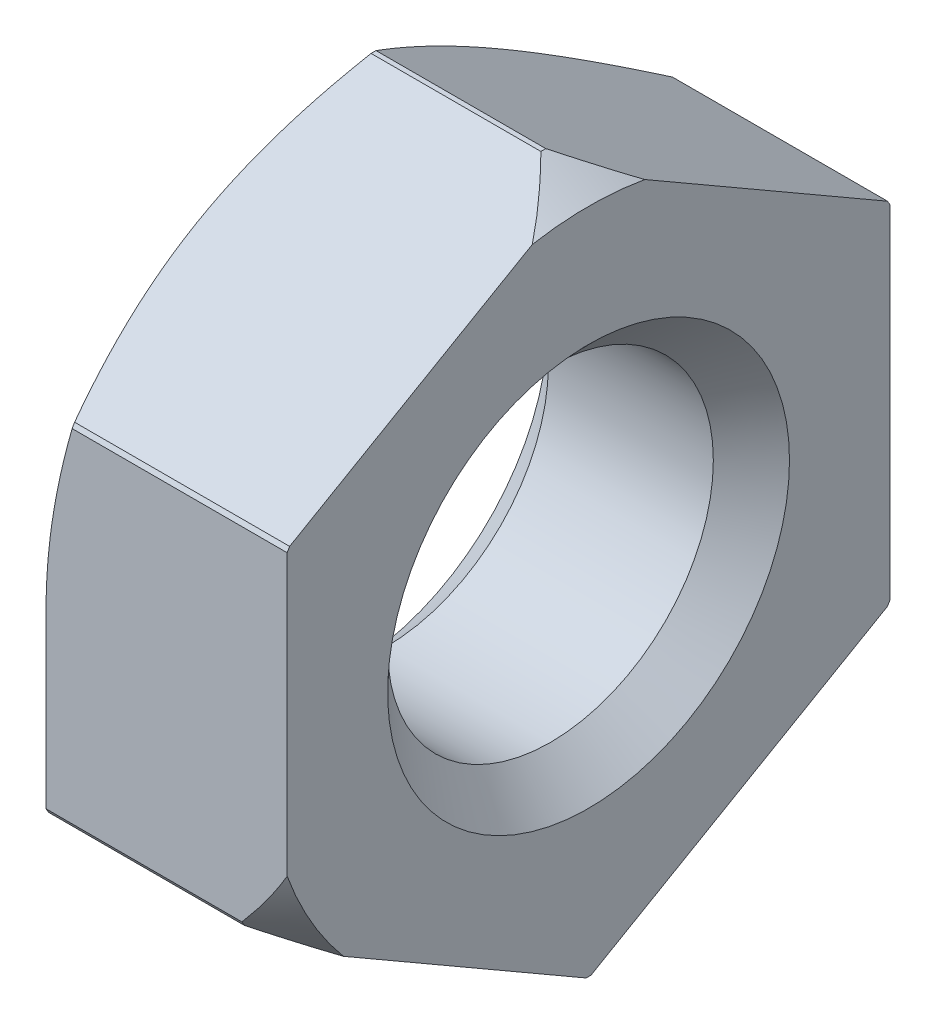
from build123d import *
from OCP.BRepFilletAPI import BRepFilletAPI_MakeChamfer

# Parameters (mm, degrees)
EXTRUDE_1_DEPTH    = 2.4
HOLE_WIZARD_M3_1_D = 3.242
CHAMFER_1_SIZE     = 0.45
CHAMFER_1_SIZE_2   = 0.259807621
CHAMFER_3_SIZE     = 0.379


with BuildPart() as part:
    # 草圖1 → 填料-伸長1 (new body)
    with BuildSketch(Plane(origin=(0, 0, 0), x_dir=(0, -1, 0), z_dir=(-1, 0, 0))):
        with BuildLine():
            Line((-1.746239959, 2.975423668), (-3.449912463, 0.024576332))
            ThreePointArc((-3.449912463, 0.024576332), (-3.45, 0), (-3.449912463, -0.024576332))
            Line((-3.449912463, -0.024576332), (-1.746239959, -2.975423668))
            ThreePointArc((-1.746239959, -2.975423668), (-1.725, -2.987787643), (-1.703672504, -3))
            Line((-1.703672504, -3), (1.703672504, -3))
            ThreePointArc((1.703672504, -3), (1.725, -2.987787643), (1.746239959, -2.975423668))
            Line((1.746239959, -2.975423668), (3.449912463, -0.024576332))
            ThreePointArc((3.449912463, -0.024576332), (3.45, 0), (3.449912463, 0.024576332))
            Line((3.449912463, 0.024576332), (1.746239959, 2.975423668))
            ThreePointArc((1.746239959, 2.975423668), (1.725, 2.987787643), (1.703672504, 3))
            Line((1.703672504, 3), (-1.703672504, 3))
            ThreePointArc((-1.703672504, 3), (-1.725, 2.987787643), (-1.746239959, 2.975423668))
        make_face()
    extrude(amount=-EXTRUDE_1_DEPTH)

    # M3 餘隙孔1 (through all)
    with Locations(Plane(origin=(2.4, 0, 0), x_dir=(0, 0, -1), z_dir=(1, 0, 0))):
        with Locations((0, 0)):
            Hole(HOLE_WIZARD_M3_1_D / 2)

    # 導角1
    chamfer_1_edges_1 = [part.edges().sort_by_distance(p)[0] for p in [
        (0, -3.45, 0),
    ]]
    chamfer_1_side_1 = [part.faces().sort_by_distance(p)[0] for p in [
        (0, -3.444803848, 0),
    ]]
    chamfer_1_edges_2 = [part.edges().sort_by_distance(p)[0] for p in [
        (0, 1.725, 2.987787643),
    ]]
    chamfer_1_side_2 = [part.faces().sort_by_distance(p)[0] for p in [
        (0.005196152, 1.725, 2.987787643),
    ]]
    chamfer_1_edges_3 = [part.edges().sort_by_distance(p)[0] for p in [
        (0, 3.45, 0),
    ]]
    chamfer_1_side_3 = [part.faces().sort_by_distance(p)[0] for p in [
        (0, 3.444803848, 0),
    ]]
    chamfer_1_edges_4 = [part.edges().sort_by_distance(p)[0] for p in [
        (0, 1.725, -2.987787643),
    ]]
    chamfer_1_side_4 = [part.faces().sort_by_distance(p)[0] for p in [
        (0, 1.722401924, -2.983287643),
    ]]
    chamfer_1_edges_5 = [part.edges().sort_by_distance(p)[0] for p in [
        (0, -1.725, -2.987787643),
    ]]
    chamfer_1_side_5 = [part.faces().sort_by_distance(p)[0] for p in [
        (0, -1.722401924, -2.983287643),
    ]]
    chamfer_1_edges_6 = [part.edges().sort_by_distance(p)[0] for p in [
        (2.4, -1.725, 2.987787643),
    ]]
    chamfer_1_side_6 = [part.faces().sort_by_distance(p)[0] for p in [
        (2.4, -1.722401924, 2.983287643),
    ]]
    chamfer_1_edges_7 = [part.edges().sort_by_distance(p)[0] for p in [
        (2.4, 3.45, 0),
    ]]
    chamfer_1_side_7 = [part.faces().sort_by_distance(p)[0] for p in [
        (2.4, 3.444803848, 0),
    ]]
    chamfer_1 = BRepFilletAPI_MakeChamfer(part.part.solid().wrapped)
    for e in chamfer_1_edges_1:
        chamfer_1.Add(CHAMFER_1_SIZE - 0.0001, CHAMFER_1_SIZE_2 - 0.0001, e.wrapped, chamfer_1_side_1[0].wrapped)
    for e in chamfer_1_edges_2:
        chamfer_1.Add(CHAMFER_1_SIZE_2 - 0.0001, CHAMFER_1_SIZE - 0.0001, e.wrapped, chamfer_1_side_2[0].wrapped)
    for e in chamfer_1_edges_3:
        chamfer_1.Add(CHAMFER_1_SIZE - 0.0001, CHAMFER_1_SIZE_2 - 0.0001, e.wrapped, chamfer_1_side_3[0].wrapped)
    for e in chamfer_1_edges_4:
        chamfer_1.Add(CHAMFER_1_SIZE - 0.0001, CHAMFER_1_SIZE_2 - 0.0001, e.wrapped, chamfer_1_side_4[0].wrapped)
    for e in chamfer_1_edges_5:
        chamfer_1.Add(CHAMFER_1_SIZE - 0.0001, CHAMFER_1_SIZE_2 - 0.0001, e.wrapped, chamfer_1_side_5[0].wrapped)
    for e in chamfer_1_edges_6:
        chamfer_1.Add(CHAMFER_1_SIZE_2 - 0.0001, CHAMFER_1_SIZE - 0.0001, e.wrapped, chamfer_1_side_6[0].wrapped)
    for e in chamfer_1_edges_7:
        chamfer_1.Add(CHAMFER_1_SIZE_2 - 0.0001, CHAMFER_1_SIZE - 0.0001, e.wrapped, chamfer_1_side_7[0].wrapped)
    add(Compound.cast(chamfer_1.Shape()), mode=Mode.REPLACE)  # a hair under: the kernel refuses the full size

    # 導角3
    chamfer_3_edges = [part.edges().sort_by_distance(p)[0] for p in [
        (2.4, 0, -1.621),
        (0, 0, -1.621),
    ]]
    chamfer(chamfer_3_edges, length=CHAMFER_3_SIZE)


solid = part.part
